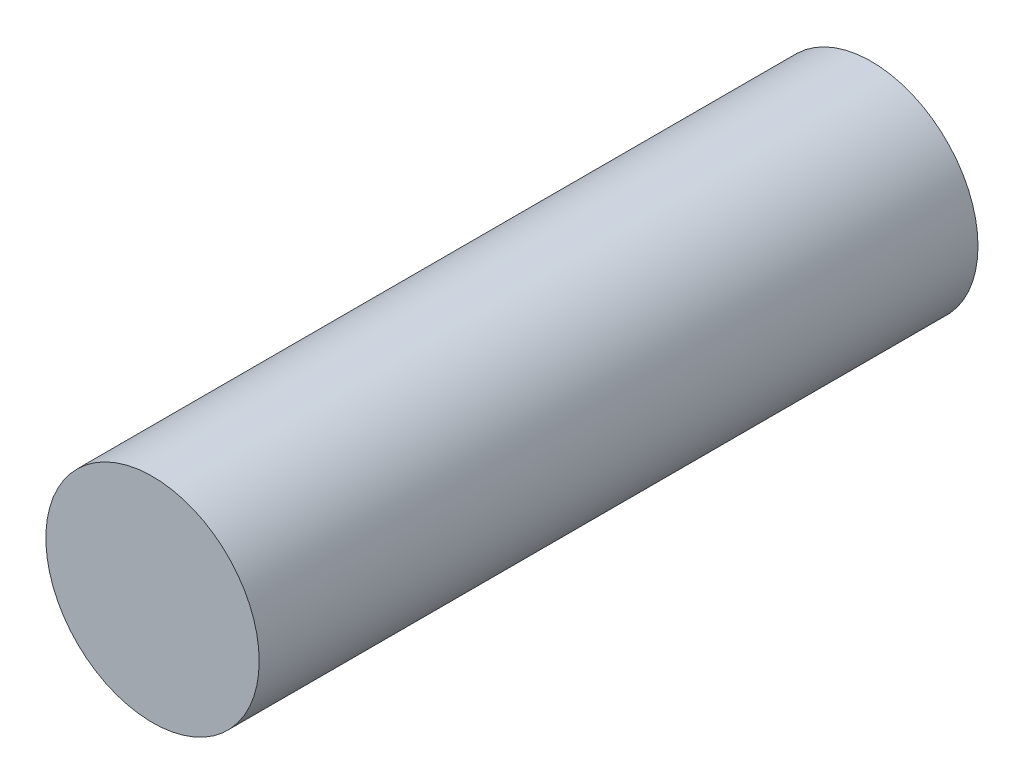
from build123d import *

# Parameters (mm, degrees)
SKETCH1_R           = 2.3
BOSS_EXTRUDE1_DEPTH = 15.5


with BuildPart() as part:
    # Sketch1 → Boss-Extrude1 (new body)
    with BuildSketch(Plane.XY):
        Circle(SKETCH1_R)
    extrude(amount=BOSS_EXTRUDE1_DEPTH)


solid = part.part
